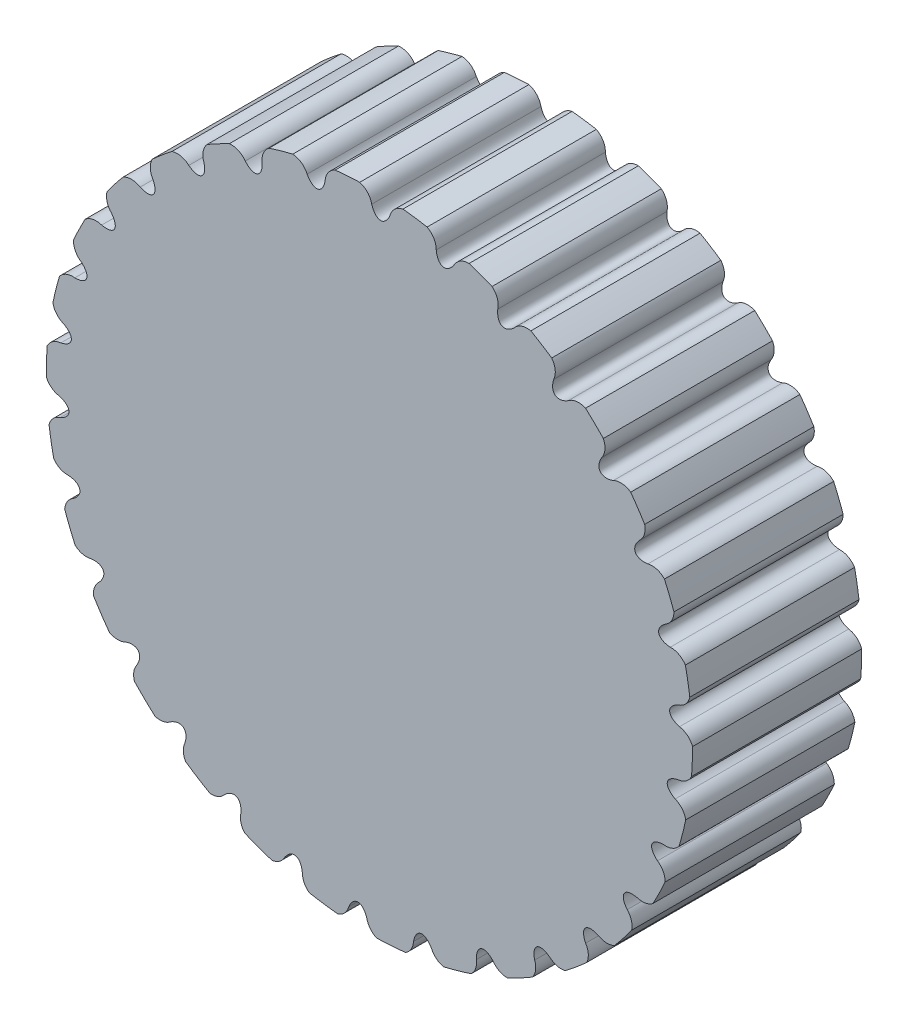
from build123d import *

# Parameters (mm, degrees)
SKETCH_1_R               = 28.647889755
EXTRUDE_1_DEPTH          = 15
CUT_EXTRUDE_3_DEPTH      = 15
PATTERN_CIRCULAR_1_DEPTH = 15


# Read off the part's stored shape, not the designer's step: Круговой массив1
with BuildPart() as part:
    # Эскиз1 → Бобышка-Вытянуть1 (new body)
    with BuildSketch(Plane.XY):
        Circle(SKETCH_1_R)
    extrude(amount=EXTRUDE_1_DEPTH)

    # Эскиз2 → Вырез-Вытянуть3 (cut)
    with BuildSketch(Plane.XY.offset(15)):
        with BuildLine():
            Line((4.783265488, 28.313897399), (4.555060767, 28.370295608))
            Line((4.555060767, 28.370295608), (7.420191225, 29.5242539))
            Line((7.420191225, 29.5242539), (9.194548177, 27.20324794))
            ThreePointArc((9.194548177, 27.20324794), (8.209649641, 27.119585332), (7.490641127, 26.441314505))
            add(Edge.make_bspline(
                [(5.923227103, 26.83594973), (6.165415766, 24.487827022), (7.490641127, 26.441314505)],
                knots=[5.342155302, 5.342155302, 5.342155302, 7.224215313, 7.224215313, 7.224215313], degree=2, weights=[1, 0.588955923, 1]))
            ThreePointArc((5.923227103, 26.83594973), (5.611124163, 27.773828354), (4.783265488, 28.313897399))
        make_face()
    extrude(amount=-CUT_EXTRUDE_3_DEPTH, mode=Mode.SUBTRACT)

    # Круговой массив1 outline → Круговой массив1 (cut)
    with BuildSketch(Plane.XY):
        with BuildLine():
            ThreePointArc((-0.857374536, 28.635057121), (-0.162957427, 28.208698815), (0.206087934, 27.482198954))
            add(Edge.make_bspline(
                [(0.206087934, 27.482198954), (0.931186357, 25.235742215), (1.821299478, 27.422071155)],
                knots=[5.342155302, 5.342155302, 5.342155302, 7.224215313, 7.224215313, 7.224215313], degree=2, weights=[1, 0.588955923, 1]))
            ThreePointArc((1.821299478, 27.422071155), (2.244682428, 28.120376446), (2.971136581, 28.493401602))
            ThreePointArc((2.971136581, 28.493401602), (1.059251654, 28.628300218), (-0.857374536, 28.635057121))
        make_face()
        with BuildLine():
            ThreePointArc((12.832183285, 24.303267333), (13.501250761, 24.768396637), (14.314771432, 24.815094323))
            ThreePointArc((14.314771432, 24.815094323), (12.623452266, 25.716726859), (10.875629889, 26.503250026))
            ThreePointArc((10.875629889, 26.503250026), (11.338834392, 25.830698896), (11.381070295, 25.015162532))
            add(Edge.make_bspline(
                [(11.381070295, 25.015162532), (11.129764393, 22.667998084), (12.832183285, 24.303267333)],
                knots=[5.342155302, 5.342155302, 5.342155302, 7.224215313, 7.224215313, 7.224215313], degree=2, weights=[1, 0.588955923, 1]))
        make_face()
        with BuildLine():
            ThreePointArc((17.612474929, 21.10137256), (18.358599847, 21.416600687), (19.159842369, 21.297934825))
            ThreePointArc((19.159842369, 21.297934825), (17.699326857, 22.526327181), (16.160266483, 23.654753743))
            ThreePointArc((16.160266483, 23.654753743), (16.469724734, 22.902549902), (16.341083574, 22.099414496))
            add(Edge.make_bspline(
                [(16.341083574, 22.099414496), (15.60726638, 19.855790658), (17.612474929, 21.10137256)],
                knots=[5.342155302, 5.342155302, 5.342155302, 7.224215313, 7.224215313, 7.224215313], degree=2, weights=[1, 0.588955923, 1]))
        make_face()
        with BuildLine():
            ThreePointArc((21.622594375, 16.975568352), (22.410584503, 17.129375348), (23.165022955, 16.854770805))
            ThreePointArc((23.165022955, 16.854770805), (21.999775921, 18.349698823), (20.738225155, 19.764301275))
            ThreePointArc((20.738225155, 19.764301275), (20.878729366, 18.969013093), (20.586490558, 18.216137803))
            add(Edge.make_bspline(
                [(20.586490558, 18.216137803), (19.402233404, 16.174111702), (21.622594375, 16.975568352)],
                knots=[5.342155302, 5.342155302, 5.342155302, 7.224215313, 7.224215313, 7.224215313], degree=2, weights=[1, 0.588955923, 1]))
        make_face()
        with BuildLine():
            ThreePointArc((24.687280161, 12.10617215), (25.481178928, 12.09537403), (26.158350936, 11.680850301))
            ThreePointArc((26.158350936, 11.680850301), (25.336556291, 13.370134734), (24.405814099, 15.001927399))
            ThreePointArc((24.405814099, 15.001927399), (24.37163839, 14.202928876), (23.931746591, 13.535050278))
            add(Edge.make_bspline(
                [(23.931746591, 13.535050278), (22.348807198, 11.783868255), (24.687280161, 12.10617215)],
                knots=[5.342155302, 5.342155302, 5.342155302, 7.224215313, 7.224215313, 7.224215313], degree=2, weights=[1, 0.588955923, 1]))
        make_face()
        with BuildLine():
            ThreePointArc((26.672590812, 6.705999934), (27.437627943, 6.535289378), (28.012098975, 6.001991207))
            ThreePointArc((28.012098975, 6.001991207), (27.563858837, 7.80610489), (26.999554978, 9.577349243))
            ThreePointArc((26.999554978, 9.577349243), (26.794860301, 8.814063586), (26.230647931, 8.260737909))
            add(Edge.make_bspline(
                [(26.230647931, 8.260737909), (24.318208346, 6.87693502), (26.672590812, 6.705999934)],
                knots=[5.342155302, 5.342155302, 5.342155302, 7.224215313, 7.224215313, 7.224215313], degree=2, weights=[1, 0.588955923, 1]))
        make_face()
        with BuildLine():
            ThreePointArc((27.491758726, 1.011065144), (28.195948874, 0.692147013), (28.647816187, 0.06492419))
            ThreePointArc((28.647816187, 0.06492419), (28.584709819, 1.901565692), (28.403975718, 3.730382142))
            ThreePointArc((28.403975718, 3.730382142), (28.042285924, 3.039605739), (27.382721558, 2.623713456))
            add(Edge.make_bspline(
                [(27.382721558, 2.623713456), (25.224364568, 1.667768528), (27.491758726, 1.011065144)],
                knots=[5.342155302, 5.342155302, 5.342155302, 7.224215313, 7.224215313, 7.224215313], degree=2, weights=[1, 0.588955923, 1]))
        make_face()
        with BuildLine():
            ThreePointArc((27.108982334, -4.729736244), (27.724336798, -5.179251287), (28.039400855, -5.873124137))
            ThreePointArc((28.039400855, -5.873124137), (28.355168104, -4.084853649), (28.557002858, -2.280170013))
            ThreePointArc((28.557002858, -2.280170013), (28.059905537, -2.866538418), (27.337616327, -3.129658065))
            add(Edge.make_bspline(
                [(27.337616327, -3.129658065), (25.02767249, -3.615965652), (27.108982334, -4.729736244)],
                knots=[5.342155302, 5.342155302, 5.342155302, 7.224215313, 7.224215313, 7.224215313], degree=2, weights=[1, 0.588955923, 1]))
        make_face()
        with BuildLine():
            ThreePointArc((25.540990802, -10.265503661), (26.044359734, -10.823314562), (26.21407603, -11.55525012))
            ThreePointArc((26.21407603, -11.55525012), (26.886134897, -9.891275845), (27.452691243, -8.188487715))
            ThreePointArc((27.452691243, -8.188487715), (26.848014351, -8.645109932), (26.097303553, -8.747926709))
            add(Edge.make_bspline(
                [(26.097303553, -8.747926709), (23.736728498, -8.743342979), (25.540990802, -10.265503661)],
                knots=[5.342155302, 5.342155302, 5.342155302, 7.224215313, 7.224215313, 7.224215313], degree=2, weights=[1, 0.588955923, 1]))
        make_face()
        with BuildLine():
            ThreePointArc((22.856312883, -15.354297507), (23.229903283, -15.994639434), (23.251200211, -16.735688697))
            ThreePointArc((23.251200211, -16.735688697), (24.242719206, -15.264080485), (25.141227491, -13.733909413))
            ThreePointArc((25.141227491, -13.733909413), (24.4609655, -14.042989432), (23.715990856, -13.985547177))
            add(Edge.make_bspline(
                [(23.715990856, -13.985547177), (21.40795304, -13.490272462), (22.856312883, -15.354297507)],
                knots=[5.342155302, 5.342155302, 5.342155302, 7.224215313, 7.224215313, 7.224215313], degree=2, weights=[1, 0.588955923, 1]))
        make_face()
        with BuildLine():
            ThreePointArc((19.172281885, -19.773713073), (19.403909174, -20.468529373), (19.278931886, -21.190195203))
            ThreePointArc((19.278931886, -21.190195203), (20.541221205, -19.968971404), (21.726302463, -18.672690454))
            ThreePointArc((21.726302463, -18.672690454), (21.004535693, -18.824307162), (20.297753027, -18.613610323))
            add(Edge.make_bspline(
                [(20.297753027, -18.613610323), (18.143124779, -17.649290504), (19.172281885, -19.773713073)],
                knots=[5.342155302, 5.342155302, 5.342155302, 7.224215313, 7.224215313, 7.224215313], degree=2, weights=[1, 0.588955923, 1]))
        make_face()
        with BuildLine():
            ThreePointArc((14.64990764, -23.330600692), (14.733041941, -24.050621812), (14.468861342, -24.725566503))
            ThreePointArc((14.468861342, -24.725566503), (15.943901436, -23.801125908), (17.360070751, -22.788802755))
            ThreePointArc((17.360070751, -22.788802755), (16.631062948, -22.780697238), (15.991983462, -22.429847578))
            add(Edge.make_bspline(
                [(15.991983462, -22.429847578), (14.084932375, -21.038628059), (14.64990764, -23.330600692)],
                knots=[5.342155302, 5.342155302, 5.342155302, 7.224215313, 7.224215313, 7.224215313], degree=2, weights=[1, 0.588955923, 1]))
        make_face()
        with BuildLine():
            ThreePointArc((9.486839604, -25.869507306), (9.420504762, -26.585221903), (9.028813367, -27.187903865))
            ThreePointArc((9.028813367, -27.187903865), (10.651794196, -26.5940006), (12.236009839, -25.903313509))
            ThreePointArc((12.236009839, -25.903313509), (11.532600684, -25.740271022), (10.986864952, -25.267471063))
            add(Edge.make_bspline(
                [(10.986864952, -25.267471063), (9.410738309, -23.510154811), (9.486839604, -25.869507306)],
                knots=[5.342155302, 5.342155302, 5.342155302, 7.224215313, 7.224215313, 7.224215313], degree=2, weights=[1, 0.588955923, 1]))
        make_face()
        with BuildLine():
            ThreePointArc((3.908728626, -27.279470515), (3.697303481, -27.961993732), (3.194103602, -28.469269214))
            ThreePointArc((3.194103602, -28.469269214), (4.895897395, -28.22643754), (6.580062715, -27.881971992))
            ThreePointArc((6.580062715, -27.881971992), (5.932406683, -27.57494603), (5.501145194, -27.002463014))
            add(Edge.make_bspline(
                [(5.501145194, -27.002463014), (4.324827293, -24.955853184), (3.908728626, -27.279470515)],
                knots=[5.342155302, 5.342155302, 5.342155302, 7.224215313, 7.224215313, 7.224215313], degree=2, weights=[1, 0.588955923, 1]))
        make_face()
        with BuildLine():
            ThreePointArc((-1.840635079, -27.498868159), (-2.187677095, -28.120727086), (-2.78240365, -28.512450216))
            ThreePointArc((-2.78240365, -28.512450216), (-1.072871909, -28.627793022), (0.640497695, -28.640728869))
            ThreePointArc((0.640497695, -28.640728869), (0.075146707, -28.205840177), (-0.225423536, -27.558995958))
            add(Edge.make_bspline(
                [(-0.225423536, -27.558995958), (-0.950521958, -25.312539219), (-1.840635079, -27.498868159)],
                knots=[5.342155302, 5.342155302, 5.342155302, 7.224215313, 7.224215313, 7.224215313], degree=2, weights=[1, 0.588955923, 1]))
        make_face()
        with BuildLine():
            ThreePointArc((-7.509976728, -26.518111509), (-7.978370842, -27.053976967), (-8.641038475, -27.313623734))
            ThreePointArc((-8.641038475, -27.313623734), (-6.9945273, -27.780895869), (-5.323050455, -28.149009242))
            ThreePointArc((-5.323050455, -28.149009242), (-5.783761563, -27.606524107), (-5.942562704, -26.912746734))
            add(Edge.make_bspline(
                [(-5.942562704, -26.912746734), (-6.184751368, -24.564624026), (-7.509976728, -26.518111509)],
                knots=[5.342155302, 5.342155302, 5.342155302, 7.224215313, 7.224215313, 7.224215313], degree=2, weights=[1, 0.588955923, 1]))
        make_face()
        with BuildLine():
            ThreePointArc((-12.851518886, -24.380064337), (-13.422555546, -24.80745996), (-14.126437165, -24.922787975))
            ThreePointArc((-14.126437165, -24.922787975), (-12.611215775, -25.722729717), (-11.050881714, -26.430656457))
            ThreePointArc((-11.050881714, -26.430656457), (-11.38920951, -25.804013831), (-11.400405897, -25.091959536))
            add(Edge.make_bspline(
                [(-11.400405897, -25.091959536), (-11.149099994, -22.744795088), (-12.851518886, -24.380064337)],
                knots=[5.342155302, 5.342155302, 5.342155302, 7.224215313, 7.224215313, 7.224215313], degree=2, weights=[1, 0.588955923, 1]))
        make_face()
        with BuildLine():
            ThreePointArc((-17.63181053, -21.178169564), (-18.28274456, -21.478183093), (-18.998571432, -21.441918547))
            ThreePointArc((-18.998571432, -21.441918547), (-17.678313507, -22.542821894), (-16.294401948, -23.562556155))
            ThreePointArc((-16.294401948, -23.562556155), (-16.49739744, -22.877478541), (-16.360419175, -22.1762115))
            add(Edge.make_bspline(
                [(-16.360419175, -22.1762115), (-15.626601981, -19.932587662), (-17.63181053, -21.178169564)],
                knots=[5.342155302, 5.342155302, 5.342155302, 7.224215313, 7.224215313, 7.224215313], degree=2, weights=[1, 0.588955923, 1]))
        make_face()
        with BuildLine():
            ThreePointArc((-21.641929976, -17.052365356), (-22.346487111, -17.210373169), (-23.043239243, -17.020890476))
            ThreePointArc((-23.043239243, -17.020890476), (-21.974961644, -18.379408264), (-20.826710345, -19.671037684))
            ThreePointArc((-20.826710345, -19.671037684), (-20.886313744, -18.954731126), (-20.60582616, -18.292934807))
            add(Edge.make_bspline(
                [(-20.60582616, -18.292934807), (-19.421569006, -16.250908707), (-21.641929976, -17.052365356)],
                knots=[5.342155302, 5.342155302, 5.342155302, 7.224215313, 7.224215313, 7.224215313], degree=2, weights=[1, 0.588955923, 1]))
        make_face()
        with BuildLine():
            ThreePointArc((-24.706615762, -12.182969154), (-25.435640514, -12.189364753), (-26.081571728, -11.851295441))
            ThreePointArc((-26.081571728, -11.851295441), (-25.313610369, -13.413527406), (-24.452181812, -14.926231675))
            ThreePointArc((-24.452181812, -14.926231675), (-24.365257967, -14.206658253), (-23.951082192, -13.611847282))
            add(Edge.make_bspline(
                [(-23.951082192, -13.611847282), (-22.368142799, -11.860665259), (-24.706615762, -12.182969154)],
                knots=[5.342155302, 5.342155302, 5.342155302, 7.224215313, 7.224215313, 7.224215313], degree=2, weights=[1, 0.588955923, 1]))
        make_face()
        with BuildLine():
            ThreePointArc((-26.691926413, -6.782796938), (-27.414215692, -6.633689604), (-27.9781356, -6.158369568))
            ThreePointArc((-27.9781356, -6.158369568), (-27.548174286, -7.861277305), (-27.014667971, -9.534636951))
            ThreePointArc((-27.014667971, -9.534636951), (-26.783013157, -8.839829882), (-26.249983532, -8.337534914))
            add(Edge.make_bspline(
                [(-26.249983532, -8.337534914), (-24.337543947, -6.953732025), (-26.691926413, -6.782796938)],
                knots=[5.342155302, 5.342155302, 5.342155302, 7.224215313, 7.224215313, 7.224215313], degree=2, weights=[1, 0.588955923, 1]))
        make_face()
        with BuildLine():
            ThreePointArc((-27.511094327, -1.087862148), (-28.194451259, -0.785686653), (-28.647250829, -0.191330468))
            ThreePointArc((-28.647250829, -0.191330468), (-28.580450721, -1.964541662), (-28.403997586, -3.730215608))
            ThreePointArc((-28.403997586, -3.730215608), (-28.034329199, -3.087601599), (-27.402057159, -2.70051046))
            add(Edge.make_bspline(
                [(-27.402057159, -2.70051046), (-25.243700169, -1.744565532), (-27.511094327, -1.087862148)],
                knots=[5.342155302, 5.342155302, 5.342155302, 7.224215313, 7.224215313, 7.224215313], degree=2, weights=[1, 0.588955923, 1]))
        make_face()
        with BuildLine():
            ThreePointArc((-27.128317935, 4.65293924), (-27.740839365, 5.098983378), (-28.057199417, 5.787499312))
            ThreePointArc((-28.057199417, 5.787499312), (-28.364514485, 4.019440926), (-28.560525818, 2.235610059))
            ThreePointArc((-28.560525818, 2.235610059), (-28.064448769, 2.799915602), (-27.356951928, 3.052861061))
            add(Edge.make_bspline(
                [(-27.356951928, 3.052861061), (-25.047008091, 3.539168647), (-27.128317935, 4.65293924)],
                knots=[5.342155302, 5.342155302, 5.342155302, 7.224215313, 7.224215313, 7.224215313], degree=2, weights=[1, 0.588955923, 1]))
        make_face()
        with BuildLine():
            ThreePointArc((-25.560326403, 10.188706657), (-26.071906236, 10.762483272), (-26.232073769, 11.514334249))
            ThreePointArc((-26.232073769, 11.514334249), (-26.908877838, 9.829236027), (-27.477560699, 8.104643446))
            ThreePointArc((-27.477560699, 8.104643446), (-26.871488669, 8.566597426), (-26.116639154, 8.671129705))
            add(Edge.make_bspline(
                [(-26.116639154, 8.671129705), (-23.756064099, 8.666545975), (-25.560326403, 10.188706657)],
                knots=[5.342155302, 5.342155302, 5.342155302, 7.224215313, 7.224215313, 7.224215313], degree=2, weights=[1, 0.588955923, 1]))
        make_face()
        with BuildLine():
            ThreePointArc((-22.875648484, 15.277500503), (-23.259639027, 15.956133457), (-23.251102266, 16.735824773))
            ThreePointArc((-23.251102266, 16.735824773), (-24.276291668, 15.210629513), (-25.201582745, 13.622841645))
            ThreePointArc((-25.201582745, 13.622841645), (-24.506578542, 13.961311127), (-23.735326457, 13.908750173))
            add(Edge.make_bspline(
                [(-23.735326457, 13.908750173), (-21.427288642, 13.413475458), (-22.875648484, 15.277500503)],
                knots=[5.342155302, 5.342155302, 5.342155302, 7.224215313, 7.224215313, 7.224215313], degree=2, weights=[1, 0.588955923, 1]))
        make_face()
        with BuildLine():
            ThreePointArc((-19.191617486, 19.696916069), (-19.426545128, 20.451444923), (-19.245395299, 21.220658501))
            ThreePointArc((-19.245395299, 21.220658501), (-20.581161725, 19.927803928), (-21.830266635, 18.551038947))
            ThreePointArc((-21.830266635, 18.551038947), (-21.071752285, 18.748725017), (-20.317088628, 18.536813319))
            add(Edge.make_bspline(
                [(-20.317088628, 18.536813319), (-18.16246038, 17.5724935), (-19.191617486, 19.696916069)],
                knots=[5.342155302, 5.342155302, 5.342155302, 7.224215313, 7.224215313, 7.224215313], degree=2, weights=[1, 0.588955923, 1]))
        make_face()
        with BuildLine():
            ThreePointArc((-14.669243241, 23.253803687), (-14.740427771, 24.050358316), (-14.392177641, 24.770280785))
            ThreePointArc((-14.392177641, 24.770280785), (-15.98465954, 23.773772245), (-17.508407188, 22.675036165))
            ThreePointArc((-17.508407188, 22.675036165), (-16.715679725, 22.719476303), (-16.011319063, 22.353050574))
            add(Edge.make_bspline(
                [(-16.011319063, 22.353050574), (-14.104267976, 20.961831054), (-14.669243241, 23.253803687)],
                knots=[5.342155302, 5.342155302, 5.342155302, 7.224215313, 7.224215313, 7.224215313], degree=2, weights=[1, 0.588955923, 1]))
        make_face()
        with BuildLine():
            ThreePointArc((-9.506175206, 25.792710302), (-9.407061789, 26.594209629), (-8.906714626, 27.228147605))
            ThreePointArc((-8.906714626, 27.228147605), (-10.687718473, 26.579583541), (-12.421936978, 25.814667712))
            ThreePointArc((-12.421936978, 25.814667712), (-11.627411248, 25.699282187), (-11.006200554, 25.190674058))
            add(Edge.make_bspline(
                [(-11.006200554, 25.190674058), (-9.430073911, 23.433357807), (-9.506175206, 25.792710302)],
                knots=[5.342155302, 5.342155302, 5.342155302, 7.224215313, 7.224215313, 7.224215313], degree=2, weights=[1, 0.588955923, 1]))
        make_face()
        with BuildLine():
            ThreePointArc((-3.928064227, 27.20267351), (-3.661058057, 27.970972068), (-3.032301922, 28.486957234))
            ThreePointArc((-3.032301922, 28.486957234), (-4.922216324, 28.221859858), (-6.790287254, 27.831521453))
            ThreePointArc((-6.790287254, 27.831521453), (-6.028379538, 27.556625578), (-5.520480796, 26.92566601))
            add(Edge.make_bspline(
                [(-5.520480796, 26.92566601), (-4.344162894, 24.879056179), (-3.928064227, 27.20267351)],
                knots=[5.342155302, 5.342155302, 5.342155302, 7.224215313, 7.224215313, 7.224215313], degree=2, weights=[1, 0.588955923, 1]))
        make_face()
    extrude(amount=PATTERN_CIRCULAR_1_DEPTH, mode=Mode.SUBTRACT)


solid = part.part
